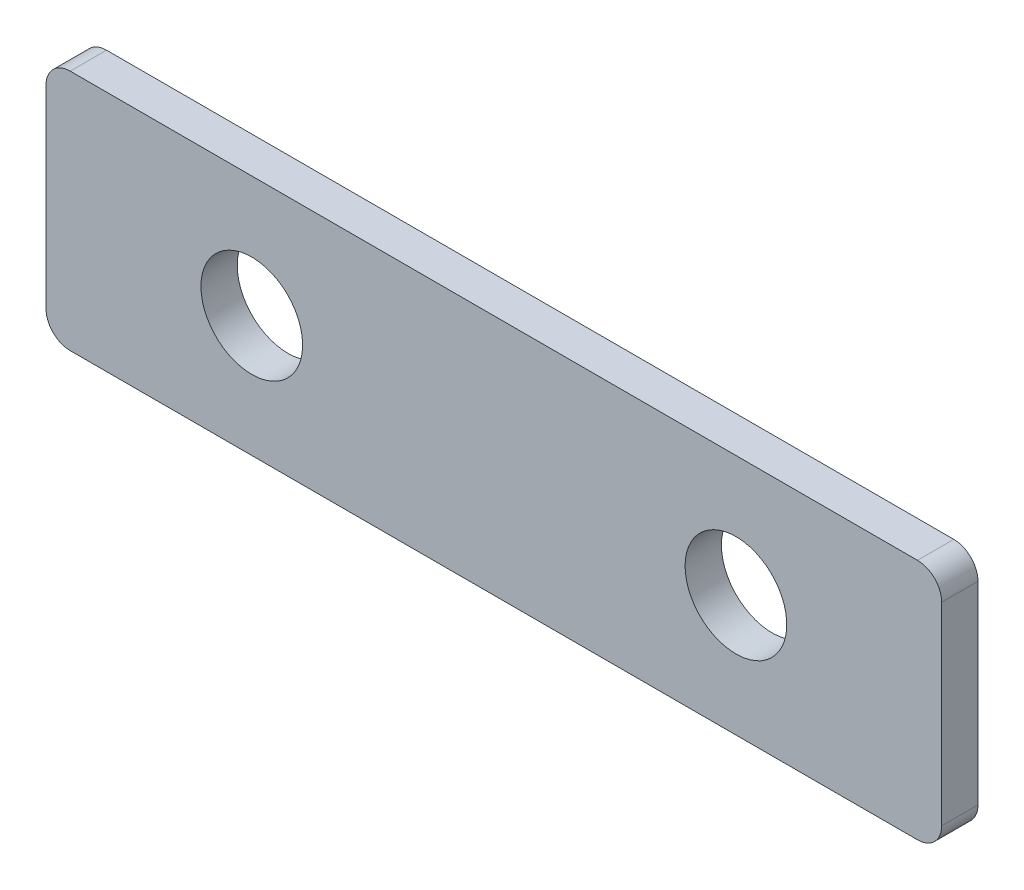
from build123d import *

# Parameters (mm, degrees)
SKETCH1_R           = 2.1
BOSS_EXTRUDE1_DEPTH = 1.5


with BuildPart() as part:
    # Sketch1 → Boss-Extrude1 (new body)
    with BuildSketch(Plane.XY):
        with BuildLine():
            Line((-17.5, -5), (17.5, -5))
            ThreePointArc((17.5, -5), (18.207106781, -4.707106781), (18.5, -4))
            Line((18.5, -4), (18.5, 4))
            ThreePointArc((18.5, 4), (18.207106781, 4.707106781), (17.5, 5))
            Line((17.5, 5), (-17.5, 5))
            ThreePointArc((-17.5, 5), (-18.207106781, 4.707106781), (-18.5, 4))
            Line((-18.5, 4), (-18.5, -4))
            ThreePointArc((-18.5, -4), (-18.207106781, -4.707106781), (-17.5, -5))
        make_face()
        with Locations((-10, 0)):
            Circle(SKETCH1_R, mode=Mode.SUBTRACT)
        with Locations((10, 0)):
            Circle(SKETCH1_R, mode=Mode.SUBTRACT)
    extrude(amount=BOSS_EXTRUDE1_DEPTH)


solid = part.part
